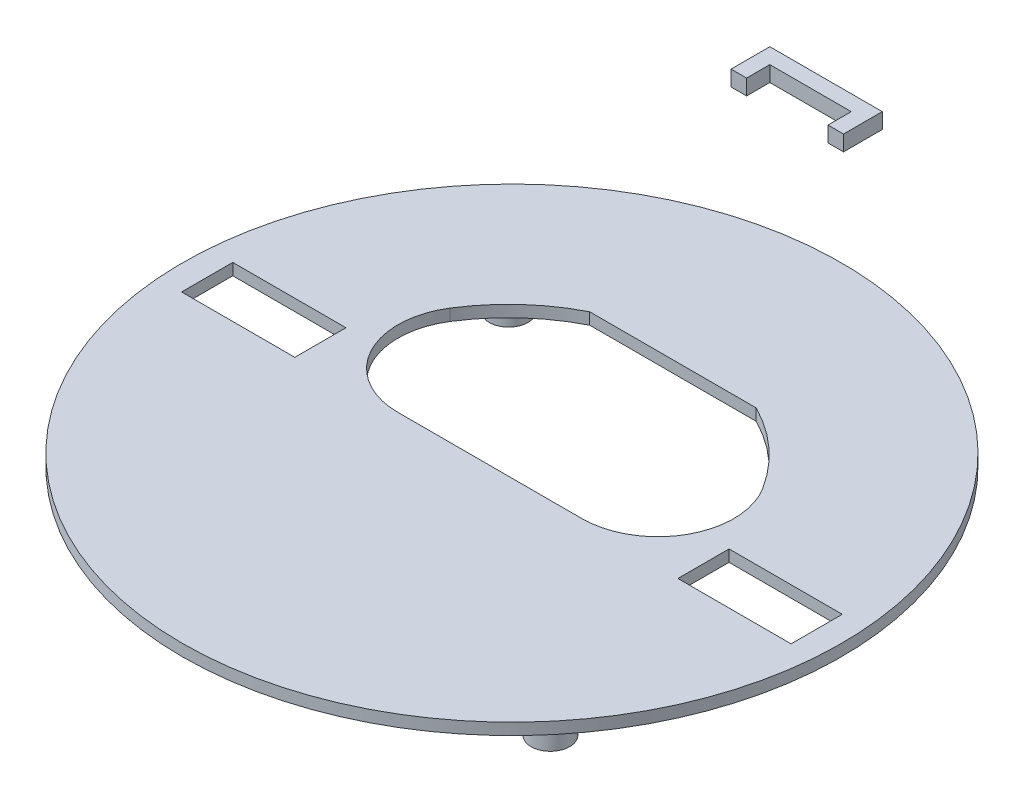
from build123d import *

# Parameters (mm, degrees)
CUT_EXTRUDE1_DEPTH           = 5
CUT_EXTRUDE3_DEPTH           = 60
SKETCH8_R                    = 43
CUT_EXTRUDE4_DEPTH           = 53
FILLET1_R                    = 7
SKETCH12_W                   = 6.5
SKETCH12_H                   = 51.5
CUT_REVOLVE1_ANGLE           = 60
CUT_REVOLVE1_OTHER_WAY_ANGLE = 60
SKETCH18_W                   = 13
SKETCH18_H                   = 8
CUT_EXTRUDE13_DEPTH          = 5
SKETCH20_W                   = 100
SKETCH20_H                   = 7
CUT_EXTRUDE15_DEPTH          = 5
SKETCH19_R                   = 1.5
CUT_EXTRUDE14_DEPTH          = 12
FILLET3_R                    = 4
SKETCH24_W                   = 2
SKETCH24_H                   = 3
BOSS_EXTRUDE3_DEPTH          = 2
CIRPATTERN2_COUNT            = 5
SKETCH26_W                   = 5
SKETCH26_H                   = 51.5
CUT_REVOLVE2_ANGLE           = 50
CUT_REVOLVE2_OTHER_WAY_ANGLE = 50
SKETCH29_W                   = 16.2
SKETCH29_H                   = 11.2
SKETCH29_W_2                 = 13
SKETCH29_H_2                 = 8
BOSS_EXTRUDE4_DEPTH          = 19
SKETCH36_W                   = 2
SKETCH36_H                   = 2
BOSS_EXTRUDE7_DEPTH          = 5
SKETCH37_W                   = 2
SKETCH37_H                   = 2
BOSS_EXTRUDE8_DEPTH          = 12.5
SKETCH40_W                   = 2
SKETCH40_H                   = 2
BOSS_EXTRUDE9_DEPTH          = 5
FILLET8_R                    = 9
SKETCH50_W                   = 13
SKETCH50_H                   = 5
CUT_EXTRUDE23_DEPTH          = 7
SKETCH51_R                   = 42.5
SKETCH51_W                   = 14.6
SKETCH51_H                   = 6.6
BOSS_EXTRUDE10_DEPTH         = 1.5
INTERSECT2_START             = 17.5
INTERSECT2_OUTLINE_R         = 45
INTERSECT2_OUTLINE_W         = 13
INTERSECT2_OUTLINE_H         = 8
INTERSECT2_DEPTH             = 59
INTERSECT2_2_OUTLINE_R       = 45
INTERSECT2_2_OUTLINE_W       = 13
INTERSECT2_2_OUTLINE_H       = 5
INTERSECT2_2_DEPTH           = 16
INTERSECT2_START_2           = 16
INTERSECT2_3_OUTLINE_R       = 45
INTERSECT2_3_OUTLINE_R_2     = 43
INTERSECT2_3_DEPTH           = 1.5
SKETCH52_R                   = 2.5
BOSS_EXTRUDE11_DEPTH         = 6


# Read off the part's stored shape, not the designer's step: Intersect2
with BuildPart() as part:
    # Sketch1 → Revolve1 (revolve)
    with BuildSketch(Plane.XY, mode=Mode.PRIVATE) as revolve1_sk:
        with BuildLine():
            Line((0, 76.5), (0, 11.5))
            Line((0, 11.5), (22.5, 11.5))
            Line((22.5, 11.5), (22.5, 0))
            Line((22.5, 0), (25, 0))
            Line((25, 0), (25, 11.5))
            Line((25, 11.5), (45, 11.5))
            Line((45, 11.5), (45, 71.5))
            ThreePointArc((45, 71.5), (43.535533906, 75.035533906), (40, 76.5))
            Line((40, 76.5), (0, 76.5))
        make_face()
    revolve(revolve1_sk.sketch.rotate(Axis((0, 2, 0), (0, 1, 0)), 90), axis=Axis((0, 2, 0), (0, 1, 0)))

    # Sketch5 → Cut-Extrude1 (cut)
    with BuildSketch(Plane(origin=(0, 76.5, 0), x_dir=(1, 0, 0), z_dir=(0, 1, 0))):
        with BuildLine():
            Line((-45, 0), (45, 0))
            ThreePointArc((45, 0), (0, 45), (-45, 0))
        make_face()
    extrude(amount=-CUT_EXTRUDE1_DEPTH, mode=Mode.SUBTRACT)

    # Sketch7 → Cut-Extrude3 (cut)
    with BuildSketch(Plane.XZ.offset(-11.5)):
        with BuildLine():
            Line((21, 0), (-21, 0))
            ThreePointArc((-21, 0), (-18.277714988, -10.340461055), (-10.816653826, -18))
            Line((-10.816653826, -18), (10.816653826, -18))
            ThreePointArc((10.816653826, -18), (18.277714988, -10.340461055), (21, 0))
        make_face()
    extrude(amount=-CUT_EXTRUDE3_DEPTH, mode=Mode.SUBTRACT)

    # Sketch8 → Cut-Extrude4 (cut)
    with BuildSketch(Plane(origin=(0, 69, 0), x_dir=(1, 0, 0), z_dir=(0, 1, 0))):
        with Locations(Location((0, 0, 0), (0, 0, 270))):
            Circle(SKETCH8_R)
        with BuildLine():
            Line((22.912878475, -2), (-22.981606036, -2))
            ThreePointArc((-22.981606036, -2), (-20.067855169, 10.855581536), (-10.573881727, 20))
            Line((-10.573881727, 20), (10.505154166, 20))
            ThreePointArc((10.505154166, 20), (19.999127608, 10.855581536), (22.912878475, -2))
        make_face(mode=Mode.SUBTRACT)
    extrude(amount=-CUT_EXTRUDE4_DEPTH, mode=Mode.SUBTRACT)

    # Fillet1
    fillet1_edges = [part.edges().sort_by_distance(p)[0] for p in [
        (-21, 41.5, 0),
        (21, 41.5, 0),
    ]]
    fillet(fillet1_edges, radius=FILLET1_R)

    # Sketch12 → Cut-Revolve1 (revolve, cut)
    with BuildSketch(Plane(origin=(0, 0, 0), x_dir=(0, 0, -1), z_dir=(1, 0, 0))):
        with Locations((-44.75, 43.25)):
            Rectangle(SKETCH12_W, SKETCH12_H)
    revolve(axis=Axis((0, 71.5, 0), (0, -1, 0)), revolution_arc=CUT_REVOLVE1_ANGLE, mode=Mode.SUBTRACT)

    # Sketch12 → Cut-Revolve1 other way (revolve, cut)
    with BuildSketch(Plane(origin=(0, 0, 0), x_dir=(0, 0, -1), z_dir=(1, 0, 0))):
        with Locations((-44.75, 43.25)):
            Rectangle(SKETCH12_W, SKETCH12_H)
    revolve(axis=Axis((0, 71.5, 0), (0, 1, 0)), revolution_arc=CUT_REVOLVE1_OTHER_WAY_ANGLE, mode=Mode.SUBTRACT)

    # Sketch18 → Cut-Extrude13 (cut)
    with BuildSketch(Plane(origin=(0, 71.5, 0), x_dir=(1, 0, 0), z_dir=(0, 1, 0))):
        with Locations((0, 30)):
            Rectangle(SKETCH18_W, SKETCH18_H)
    extrude(amount=-CUT_EXTRUDE13_DEPTH, mode=Mode.SUBTRACT)

    # Sketch20 → Cut-Extrude15 (cut)
    with BuildSketch(Plane(origin=(0, 76.5, 0), x_dir=(1, 0, 0), z_dir=(0, 1, 0))):
        with Locations((0, -3.5)):
            Rectangle(SKETCH20_W, SKETCH20_H)
    extrude(amount=-CUT_EXTRUDE15_DEPTH, mode=Mode.SUBTRACT)

    # Sketch19 → Cut-Extrude14 (cut)
    with BuildSketch(Plane(origin=(0, 0, 7), x_dir=(-1, 0, 0), z_dir=(0, 0, -1))):
        with Locations((0, 74)):
            Circle(SKETCH19_R)
        with Locations((-30, 74)):
            Circle(SKETCH19_R)
        with Locations((29.452221542, 74)):
            Circle(SKETCH19_R)
    extrude(amount=-CUT_EXTRUDE14_DEPTH, mode=Mode.SUBTRACT)

    # Fillet3
    fillet3_edges = [part.edges().sort_by_distance(p)[0] for p in [
        (0, 11.5, 45),
    ]]
    fillet(fillet3_edges, radius=FILLET3_R)

    # Sketch24 → Boss-Extrude3 (add)
    with BuildSketch(Plane.XZ):
        with Locations((0, -22.5)):
            Rectangle(SKETCH24_W, SKETCH24_H)
    boss_extrude3 = extrude(amount=-BOSS_EXTRUDE3_DEPTH)

    # CirPattern2: Boss-Extrude3 ×5 about axis
    cirpattern2_axis = Axis((0, 0, 0), (0, 1, 0))
    for i in range(1, CIRPATTERN2_COUNT):
        add(boss_extrude3.rotate(cirpattern2_axis, i * 360 / CIRPATTERN2_COUNT))

    # Sketch26 → Cut-Revolve2 (revolve, cut)
    with BuildSketch(Plane(origin=(0, 0, 0), x_dir=(0, 0, -1), z_dir=(1, 0, 0))):
        with Locations((45.056943441, 43.25)):
            Rectangle(SKETCH26_W, SKETCH26_H)
    revolve(axis=Axis((0, 2, 0), (0, -1, 0)), revolution_arc=CUT_REVOLVE2_ANGLE, mode=Mode.SUBTRACT)

    # Sketch26 → Cut-Revolve2 other way (revolve, cut)
    with BuildSketch(Plane(origin=(0, 0, 0), x_dir=(0, 0, -1), z_dir=(1, 0, 0))):
        with Locations((45.056943441, 43.25)):
            Rectangle(SKETCH26_W, SKETCH26_H)
    revolve(axis=Axis((0, 2, 0), (0, 1, 0)), revolution_arc=CUT_REVOLVE2_OTHER_WAY_ANGLE, mode=Mode.SUBTRACT)

    # Sketch29 → Boss-Extrude4 (add)
    with BuildSketch(Plane.XZ.offset(-69)):
        with Locations((0, -30)):
            Rectangle(SKETCH29_W, SKETCH29_H)
        with Locations((0, -30)):
            Rectangle(SKETCH29_W_2, SKETCH29_H_2, mode=Mode.SUBTRACT)
    extrude(amount=BOSS_EXTRUDE4_DEPTH)

    # Fillet8
    fillet8_edges = [part.edges().sort_by_distance(p)[0] for p in [
        (-22.981606036, 42.5, 2),
        (22.912878475, 42.5, 2),
    ]]
    fillet(fillet8_edges, radius=FILLET8_R)

    # Sketch50 → Cut-Extrude23 (cut)
    with BuildSketch(Plane(origin=(0, 16, 0), x_dir=(1, 0, 0), z_dir=(0, 1, 0))):
        with Locations((32, 0)):
            Rectangle(SKETCH50_W, SKETCH50_H)
        with Locations((-32, 0)):
            Rectangle(SKETCH50_W, SKETCH50_H)
    extrude(amount=-CUT_EXTRUDE23_DEPTH, mode=Mode.SUBTRACT)

    # Sketch51 → Boss-Extrude10 (add)
    with BuildSketch(Plane(origin=(0, 16, 0), x_dir=(1, 0, 0), z_dir=(0, 1, 0))):
        with Locations(Location((0, 0, 0), (0, 0, 270))):
            Circle(SKETCH51_R)
        with Locations((32, 0)):
            Rectangle(SKETCH51_W, SKETCH51_H, mode=Mode.SUBTRACT)
        with Locations((-32, 0)):
            Rectangle(SKETCH51_W, SKETCH51_H, mode=Mode.SUBTRACT)
        with BuildLine():
            ThreePointArc((-20.192156993, 12.210139591), (-20.468000439, 2.257604402), (-11.8918892, -2.8))
            Line((-11.8918892, -2.8), (11.823161639, -2.8))
            ThreePointArc((11.823161639, -2.8), (20.399272878, 2.257604402), (20.123429432, 12.210139591))
            ThreePointArc((20.123429432, 12.210139591), (15.996509538, 17.148165703), (10.697483593, 20.8))
            Line((10.697483593, 20.8), (-10.766211154, 20.8))
            ThreePointArc((-10.766211154, 20.8), (-16.065237099, 17.148165703), (-20.192156993, 12.210139591))
        make_face(mode=Mode.SUBTRACT)
    extrude(amount=BOSS_EXTRUDE10_DEPTH)

    # Intersect2 outline → Intersect2 (cut)
    with BuildSketch(Plane(origin=(0, 0, 0), x_dir=(1, 0, 0), z_dir=(0, 1, 0)).offset(INTERSECT2_START)):
        Circle(INTERSECT2_OUTLINE_R)
        with Locations((0, 30)):
            Rectangle(INTERSECT2_OUTLINE_W, INTERSECT2_OUTLINE_H, mode=Mode.SUBTRACT)
        with BuildLine():
            ThreePointArc((-18.186533479, 10.5), (-14.978608696, 14.718739128), (-10.816653826, 18))
            Line((-10.816653826, 18), (10.816653826, 18))
            ThreePointArc((10.816653826, 18), (14.978608696, 14.718739128), (18.186533479, 10.5))
            ThreePointArc((18.186533479, 10.5), (18.186533479, 3.5), (12.124355653, 0))
            Line((12.124355653, 0), (-12.124355653, 0))
            ThreePointArc((-12.124355653, 0), (-18.186533479, 3.5), (-18.186533479, 10.5))
        make_face(mode=Mode.SUBTRACT)
    extrude(amount=INTERSECT2_DEPTH, mode=Mode.SUBTRACT)

    # Intersect2 2 outline → Intersect2 2 (cut)
    with BuildSketch(Plane(origin=(0, 0, 0), x_dir=(1, 0, 0), z_dir=(0, 1, 0))):
        Circle(INTERSECT2_2_OUTLINE_R)
        with Locations((-32, 0)):
            Rectangle(INTERSECT2_2_OUTLINE_W, INTERSECT2_2_OUTLINE_H, mode=Mode.SUBTRACT)
        with Locations((32, 0)):
            Rectangle(INTERSECT2_2_OUTLINE_W, INTERSECT2_2_OUTLINE_H, mode=Mode.SUBTRACT)
        with BuildLine():
            ThreePointArc((-18.186533479, 10.5), (-14.978608696, 14.718739128), (-10.816653826, 18))
            Line((-10.816653826, 18), (10.816653826, 18))
            ThreePointArc((10.816653826, 18), (14.978608696, 14.718739128), (18.186533479, 10.5))
            ThreePointArc((18.186533479, 10.5), (18.186533479, 3.5), (12.124355653, 0))
            Line((12.124355653, 0), (-12.124355653, 0))
            ThreePointArc((-12.124355653, 0), (-18.186533479, 3.5), (-18.186533479, 10.5))
        make_face(mode=Mode.SUBTRACT)
    extrude(amount=INTERSECT2_2_DEPTH, mode=Mode.SUBTRACT)

    # Intersect2 3 outline → Intersect2 3 (cut)
    # profile 1 of 2: a face of its own
    with BuildSketch(Plane(origin=(0, 0, 0), x_dir=(1, 0, 0), z_dir=(0, 1, 0)).offset(INTERSECT2_START_2)):
        Circle(INTERSECT2_3_OUTLINE_R)
        Circle(INTERSECT2_3_OUTLINE_R_2, mode=Mode.SUBTRACT)
    # profile 2 of 2: a face of its own
    with BuildSketch(Plane(origin=(0, 0, 0), x_dir=(1, 0, 0), z_dir=(0, 1, 0)).offset(INTERSECT2_START_2)):
        with BuildLine():
            Line((-11.8918892, -2), (11.823161639, -2))
            ThreePointArc((11.823161639, -2), (19.699182165, 2.644738737), (19.445856551, 11.784822073))
            ThreePointArc((19.445856551, 11.784822073), (15.52739893, 16.493045158), (10.505154166, 20))
            Line((10.505154166, 20), (-10.573881727, 20))
            ThreePointArc((-10.573881727, 20), (-15.596126491, 16.493045158), (-19.514584112, 11.784822073))
            ThreePointArc((-19.514584112, 11.784822073), (-19.767909726, 2.644738737), (-11.8918892, -2))
        make_face()
        with BuildLine():
            Line((-10.816653826, 18), (10.816653826, 18))
            ThreePointArc((10.816653826, 18), (14.978608696, 14.718739128), (18.186533479, 10.5))
            ThreePointArc((18.186533479, 10.5), (18.186533479, 3.5), (12.124355653, 0))
            Line((12.124355653, 0), (-12.124355653, 0))
            ThreePointArc((-12.124355653, 0), (-18.186533479, 3.5), (-18.186533479, 10.5))
            ThreePointArc((-18.186533479, 10.5), (-14.978608696, 14.718739128), (-10.816653826, 18))
        make_face(mode=Mode.SUBTRACT)
    extrude(amount=INTERSECT2_3_DEPTH, mode=Mode.SUBTRACT)

    # Sketch52 → Boss-Extrude11 (add)
    with BuildSketch(Plane.XZ.offset(-16)):
        with Locations(Location((26.517708618, 21.554294378, 0), (0, 0, 90))):
            Circle(SKETCH52_R)
        with Locations(Location((4.255662389, 31.368306058, 0), (0, 0, 90))):
            Circle(SKETCH52_R)
        with Locations(Location((-26.078081375, 19.203965316, 0), (0, 0, 90))):
            Circle(SKETCH52_R)
        with Locations(Location((-23.550645182, -23.120332988, 0), (0, 0, 90))):
            Circle(SKETCH52_R)
        with Locations(Location((0, -30.823145317, 0), (0, 0, 90))):
            Circle(SKETCH52_R)
        with Locations(Location((26.517708618, -23.120332988, 0), (0, 0, 90))):
            Circle(SKETCH52_R)
    extrude(amount=BOSS_EXTRUDE11_DEPTH)


with BuildPart() as body_2:
    # Sketch36 → Boss-Extrude7 (new body)
    with BuildSketch(Plane(origin=(0, 0, -35.6), x_dir=(-1, 0, 0), z_dir=(0, 0, -1))):
        with Locations((-6.159647943, 37.918102195)):
            Rectangle(SKETCH36_W, SKETCH36_H)
    extrude(amount=BOSS_EXTRUDE7_DEPTH)

    # Sketch37 → Boss-Extrude8 (add)
    with BuildSketch(Plane.ZY.offset(-5.159647943)):
        with Locations((-39.597351245, 37.918102195)):
            Rectangle(SKETCH37_W, SKETCH37_H)
    extrude(amount=BOSS_EXTRUDE8_DEPTH)

    # Sketch40 → Boss-Extrude9 (add)
    with BuildSketch(Plane(origin=(0, 0, -35.6), x_dir=(-1, 0, 0), z_dir=(0, 0, -1))):
        with Locations((6.340352057, 37.918102195)):
            Rectangle(SKETCH40_W, SKETCH40_H)
    extrude(amount=BOSS_EXTRUDE9_DEPTH)


solid = Compound([part.part, body_2.part])
